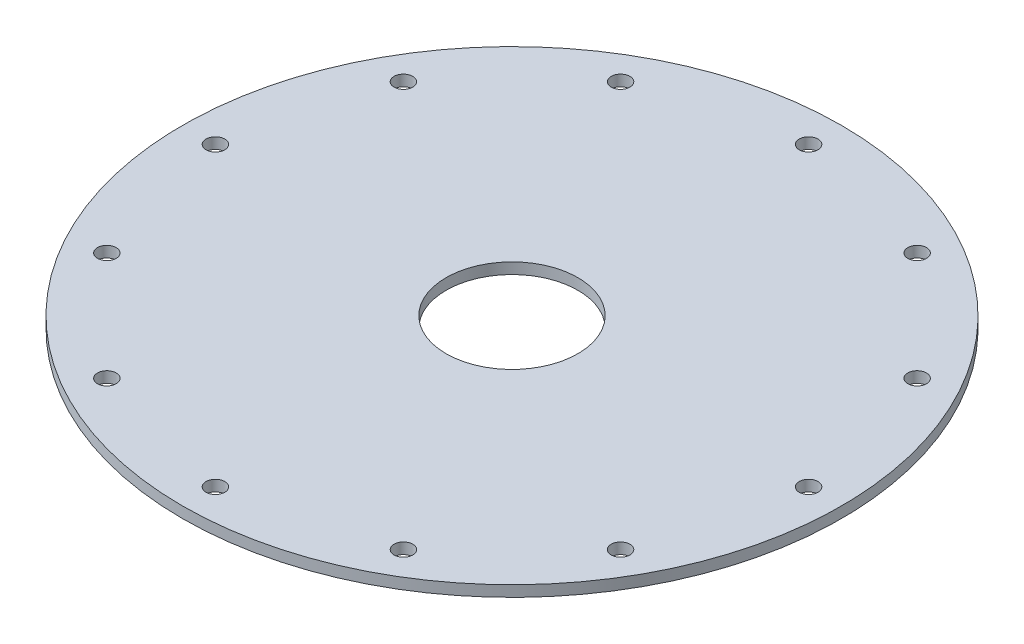
from build123d import *

# Parameters (mm, degrees)
SKETCH1_W                    = 38.1
SKETCH1_H                    = 1.5875
F_36_0_1065_DIAMETER_HOLE1_D = 2.7051
CIRPATTERN1_COUNT            = 12


with BuildPart() as part:
    # Sketch1 → Revolve1 (revolve)
    with BuildSketch(Plane.XY):
        with Locations((-28.575, 0.79375)):
            Rectangle(SKETCH1_W, SKETCH1_H)
    revolve(axis=Axis((0, 55, 0), (0, -1, 0)))

    # #36 (0.1065) Diameter Hole1 (through all)
    with Locations(Plane(origin=(0, 1.5875, 0), x_dir=(1, 0, 0), z_dir=(0, 1, 0))):
        with Locations((-42.8625, 0)):
            f_36_0_1065_diameter_hole1 = Hole(F_36_0_1065_DIAMETER_HOLE1_D / 2)

    # CirPattern1: #36 (0.1065) Diameter Hole1 ×12 about axis
    cirpattern1_axis = Axis((0, 55, 0), (0, -1, 0))
    for i in range(1, CIRPATTERN1_COUNT):
        add(f_36_0_1065_diameter_hole1.rotate(cirpattern1_axis, i * 360 / CIRPATTERN1_COUNT), mode=Mode.SUBTRACT)


solid = part.part
